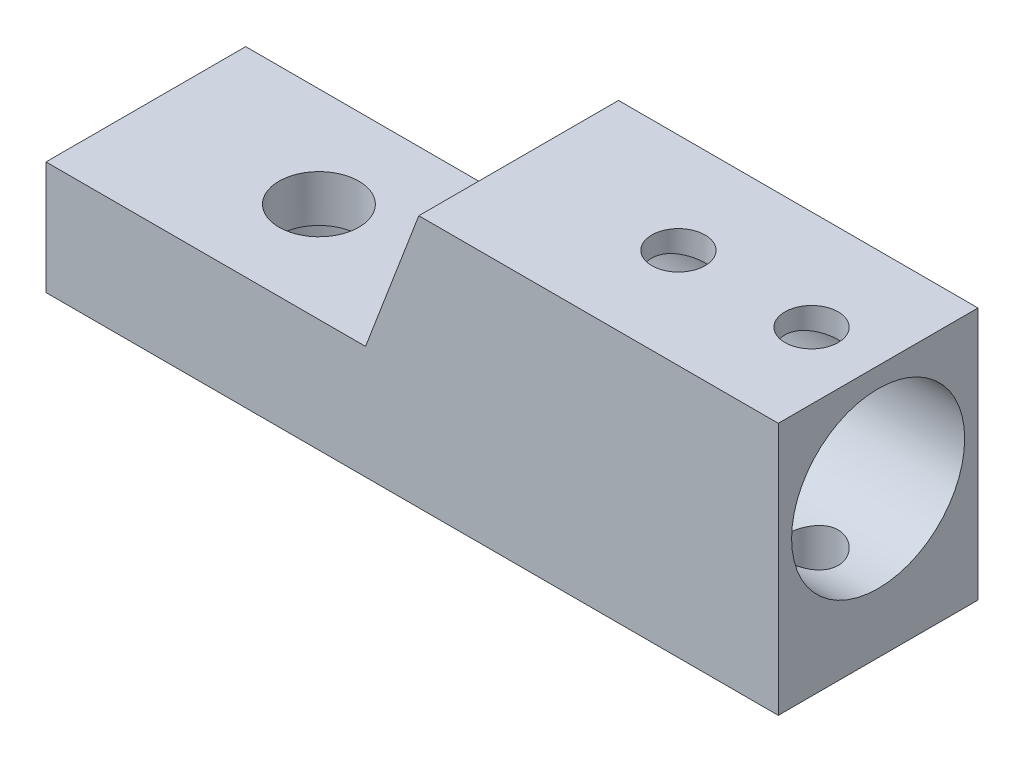
from build123d import *

# Parameters (mm, degrees)
SKETCH1_W               = 15
SKETCH1_H               = 19
SKETCH1_R               = 6.5
BOSS_EXTRUDE1_DEPTH     = 25
SKETCH2_W               = 15
SKETCH2_H               = 19
BOSS_EXTRUDE2_DEPTH     = 2
CUT_EXTRUDE1_DEPTH      = 29.324018077
CUT_EXTRUDE1_DEPTH_BACK = 29.324018077
SKETCH4_R               = 2
SKETCH3_W               = 28
SKETCH3_H               = 15
SKETCH3_R               = 3
BOSS_EXTRUDE3_DEPTH     = 8.5
CHAMFER1_SIZE2          = 10.5
CHAMFER1_SIZE           = 4
SKETCH7_R               = 6
CUT_EXTRUDE4_DEPTH      = 5


with BuildPart() as part:
    # Sketch1 → Boss-Extrude1 (new body)
    with BuildSketch(Plane(origin=(0, 0, 0), x_dir=(0, 0, -1), z_dir=(1, 0, 0))):
        with Locations((0, -1.5)):
            Rectangle(SKETCH1_W, SKETCH1_H)
        Circle(SKETCH1_R, mode=Mode.SUBTRACT)
    extrude(amount=BOSS_EXTRUDE1_DEPTH)

    # Sketch2 → Boss-Extrude2 (add)
    with BuildSketch(Plane(origin=(0, 0, 0), x_dir=(0, 0, -1), z_dir=(1, 0, 0))):
        with Locations((0, -1.5)):
            Rectangle(SKETCH2_W, SKETCH2_H)
    extrude(amount=-BOSS_EXTRUDE2_DEPTH)

    # Sketch4 → Cut-Extrude1 (cut, two sides: drawn at the far end of the back side and taken through both)
    with BuildSketch(Plane(origin=(0, 0, 0), x_dir=(1, 0, 0), z_dir=(0, 1, 0)).offset(-CUT_EXTRUDE1_DEPTH_BACK)):
        with Locations(Location((10, 0, 0), (0, 0, 270))):
            Circle(SKETCH4_R)
        with Locations(Location((20, 0, 0), (0, 0, 270))):
            Circle(SKETCH4_R)
    extrude(amount=CUT_EXTRUDE1_DEPTH + CUT_EXTRUDE1_DEPTH_BACK, mode=Mode.SUBTRACT)

    # Sketch3 → Boss-Extrude3 (add)
    with BuildSketch(Plane(origin=(0, -2.5, 0), x_dir=(1, 0, 0), z_dir=(0, 1, 0))):
        with Locations((-16, 0)):
            Rectangle(SKETCH3_W, SKETCH3_H)
        with Locations(Location((-17, 0, 0), (0, 0, 270))):
            Circle(SKETCH3_R, mode=Mode.SUBTRACT)
    extrude(amount=-BOSS_EXTRUDE3_DEPTH)

    # Chamfer1
    chamfer1_edges = [part.edges().sort_by_distance(p)[0] for p in [
        (-2, -2.5, 0),
    ]]
    chamfer1_side = [part.faces().sort_by_distance(p)[0] for p in [
        (-2.08, -2.5, 0),
    ]]
    chamfer(chamfer1_edges, length=CHAMFER1_SIZE - 0.0001, length2=CHAMFER1_SIZE2 - 0.0001, reference=chamfer1_side[0])  # a hair under: the kernel refuses the full size

    # Sketch7 → Cut-Extrude4 (cut)
    with BuildSketch(Plane.XZ.offset(11)):
        with Locations(Location((-17, 0, 0), (0, 0, 270))):
            Circle(SKETCH7_R)
    extrude(amount=-CUT_EXTRUDE4_DEPTH, mode=Mode.SUBTRACT)


solid = part.part
